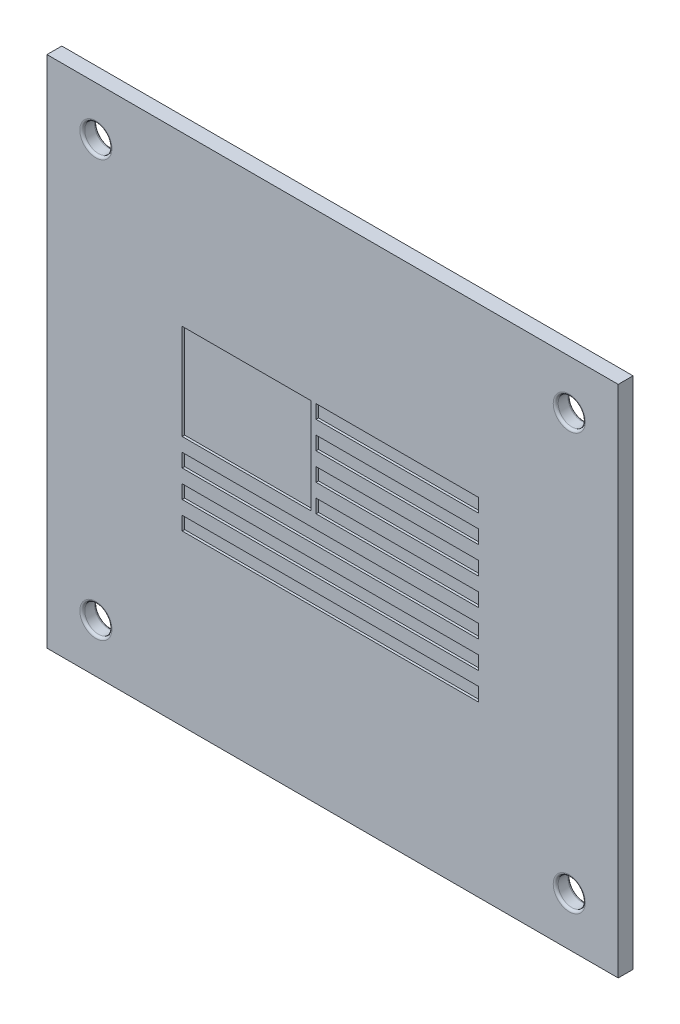
from build123d import *

# Parameters (mm, degrees)
SKETCH1_W           = 115.6
SKETCH1_H           = 104.04
BOSS_EXTRUDE1_DEPTH = 3
SKETCH2_R           = 2.75
CUT_EXTRUDE1_DEPTH  = 78.819794397
SKETCH7_W           = 26.075496749
SKETCH7_H           = 19.32
SKETCH7_W_2         = 60
SKETCH7_H_2         = 2.76
SKETCH7_W_3         = 32.924503251
CUT_EXTRUDE7_DEPTH  = 0.5
FILLET1_R           = 0.5


with BuildPart() as part:
    # Sketch1 → Boss-Extrude1 (new body)
    with BuildSketch(Plane.XY):
        Rectangle(SKETCH1_W, SKETCH1_H)
    extrude(amount=BOSS_EXTRUDE1_DEPTH)

    # Sketch2 → Cut-Extrude1 (cut, through all)
    with BuildSketch(Plane.XY.offset(3)):
        with Locations((-47.9, 42.12)):
            Circle(SKETCH2_R)
        with Locations((47.9, 42.12)):
            Circle(SKETCH2_R)
        with Locations((47.9, -42.12)):
            Circle(SKETCH2_R)
        with Locations((-47.9, -42.12)):
            Circle(SKETCH2_R)
    extrude(amount=-CUT_EXTRUDE1_DEPTH, mode=Mode.SUBTRACT)

    # Sketch7 → Cut-Extrude7 (cut)
    with BuildSketch(Plane.XY.offset(3)):
        with Locations((-17.391104772, 8.419518968)):
            Rectangle(SKETCH7_W, SKETCH7_H)
        with Locations((-0.428853146, -5.380481032)):
            Rectangle(SKETCH7_W_2, SKETCH7_H_2)
        with Locations((13.108895229, 16.699518968)):
            Rectangle(SKETCH7_W_3, SKETCH7_H_2)
        with Locations((13.108895229, 0.139518968)):
            Rectangle(SKETCH7_W_3, SKETCH7_H_2)
        with Locations((-0.428853146, -10.900481032)):
            Rectangle(SKETCH7_W_2, SKETCH7_H_2)
        with Locations((13.108895229, 11.179518968)):
            Rectangle(SKETCH7_W_3, SKETCH7_H_2)
        with Locations((13.108895229, 5.659518968)):
            Rectangle(SKETCH7_W_3, SKETCH7_H_2)
        with Locations((-0.428853146, -16.420481032)):
            Rectangle(SKETCH7_W_2, SKETCH7_H_2)
    extrude(amount=-CUT_EXTRUDE7_DEPTH, mode=Mode.SUBTRACT)

    # Fillet1
    fillet1_edges = [part.edges().sort_by_distance(p)[0] for p in [
        (45.15, 42.12, 3),
        (45.15, 42.12, 0),
        (45.15, -42.12, 3),
        (45.15, -42.12, 0),
        (-50.65, -42.12, 3),
        (-50.65, -42.12, 0),
        (-50.65, 42.12, 3),
        (-50.65, 42.12, 0),
    ]]
    fillet(fillet1_edges, radius=FILLET1_R)


solid = part.part
